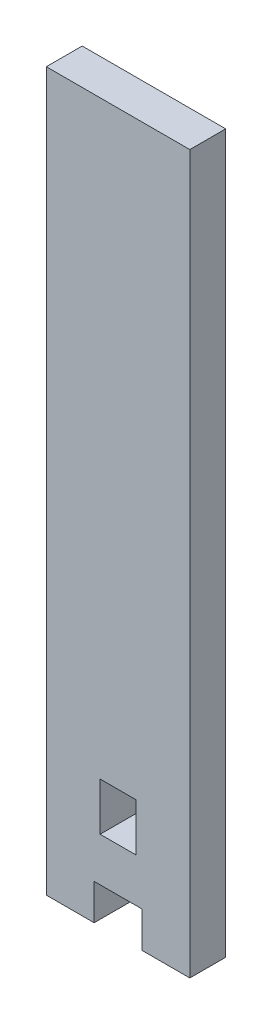
from build123d import *

# Parameters (mm, degrees)
BOSS_EXTRUDE1_DEPTH = 5
CAVITY1_START       = -38.899371069
CAVITY1_OUTLINE_W   = 5
CAVITY1_OUTLINE_H   = 5
CAVITY1_DEPTH       = 6.666666666


# Read off the part's stored shape, not the designer's step: Cavity1
with BuildPart() as part:
    # Sketch1 → Boss-Extrude1 (new body)
    with BuildSketch(Plane.XY):
        Polygon((3.333333333, -50), (10, -50), (10, 50), (-10, 50), (-10, -50), (-3.333333333, -50), (-3.333333333, -45), (3.333333333, -45), align=None)
    extrude(amount=BOSS_EXTRUDE1_DEPTH)

    # Cavity1 outline → Cavity1 (cut)
    with BuildSketch(Plane(origin=(0, 0, 0), x_dir=(1, 0, 0), z_dir=(0, 1, 0)).offset(CAVITY1_START)):
        with Locations((0, -2.5)):
            Rectangle(CAVITY1_OUTLINE_W, CAVITY1_OUTLINE_H)
    extrude(amount=CAVITY1_DEPTH, mode=Mode.SUBTRACT)


solid = part.part
